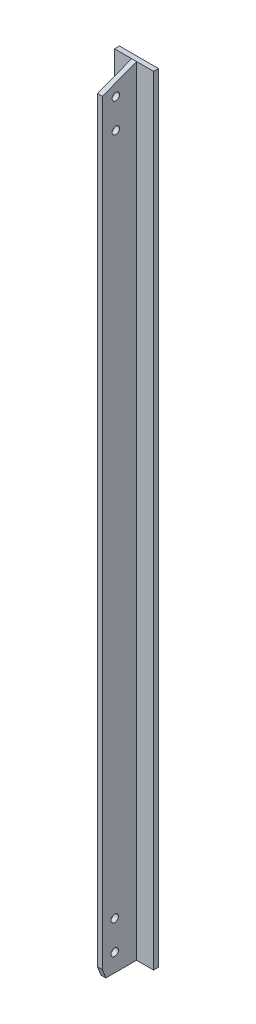
from build123d import *

# Parameters (mm, degrees)
BOSS_EXTRUDE1_DEPTH     = 558.8
CUT_EXTRUDE1_DEPTH      = 438.15
CUT_EXTRUDE2_DEPTH      = 560.559409407
CUT_EXTRUDE2_DEPTH_BACK = 560.559409407
SKETCH5_W               = 32.879526666
SKETCH5_H               = 52.07
SKETCH6_R               = 2.413
CUT_EXTRUDE3_DEPTH      = 560.559409407
SKETCH7_R               = 2.413
CUT_EXTRUDE4_DEPTH      = 560.559409407


with BuildPart() as part:
    # Sketch2 → Boss-Extrude1 (new body)
    with BuildSketch(Plane(origin=(0, 0, 0), x_dir=(1, 0, 0), z_dir=(0, 1, 0))):
        Polygon((0, 0), (3.175, 0), (3.175, 22.225), (14.2875, 22.225), (14.2875, 25.4), (-11.1125, 25.4), (-11.1125, 22.225), (0, 22.225), align=None)
    extrude(amount=BOSS_EXTRUDE1_DEPTH)

    # Sketch4 → Cut-Extrude1 (cut)
    with BuildSketch(Plane(origin=(3.175, 0, 0), x_dir=(0, 0, -1), z_dir=(1, 0, 0))):
        Polygon((22.225, 0), (0, 57.898104463), (0, 0), align=None)
        Polygon((22.225, 558.8), (0, 550.268621821), (0, 558.8), align=None)
    extrude(amount=-CUT_EXTRUDE1_DEPTH, mode=Mode.SUBTRACT)

    # Sketch5 → Cut-Extrude2 (cut, two sides: drawn at the far end of the back side and taken through both)
    with BuildSketch(Plane(origin=(3.175, 0, 0), x_dir=(0, 0, -1), z_dir=(1, 0, 0)).offset(-CUT_EXTRUDE2_DEPTH_BACK)):
        with Locations((8.960236667, 26.035)):
            Rectangle(SKETCH5_W, SKETCH5_H)
    extrude(amount=CUT_EXTRUDE2_DEPTH + CUT_EXTRUDE2_DEPTH_BACK, mode=Mode.SUBTRACT)

    # Sketch6 → Cut-Extrude3 (cut, through all)
    with BuildSketch(Plane(origin=(3.175, 0, 0), x_dir=(0, 0, -1), z_dir=(1, 0, 0))):
        with Locations((8.001, 63.754)):
            Circle(SKETCH6_R)
        with Locations((8.001, 82.804)):
            Circle(SKETCH6_R)
    extrude(amount=-CUT_EXTRUDE3_DEPTH, mode=Mode.SUBTRACT)

    # Sketch7 → Cut-Extrude4 (cut, through all)
    with BuildSketch(Plane(origin=(3.175, 0, 0), x_dir=(0, 0, -1), z_dir=(1, 0, 0))):
        with Locations((8.763, 526.69741035)):
            Circle(SKETCH7_R)
        with Locations((8.763, 545.74741035)):
            Circle(SKETCH7_R)
    extrude(amount=-CUT_EXTRUDE4_DEPTH, mode=Mode.SUBTRACT)


solid = part.part
